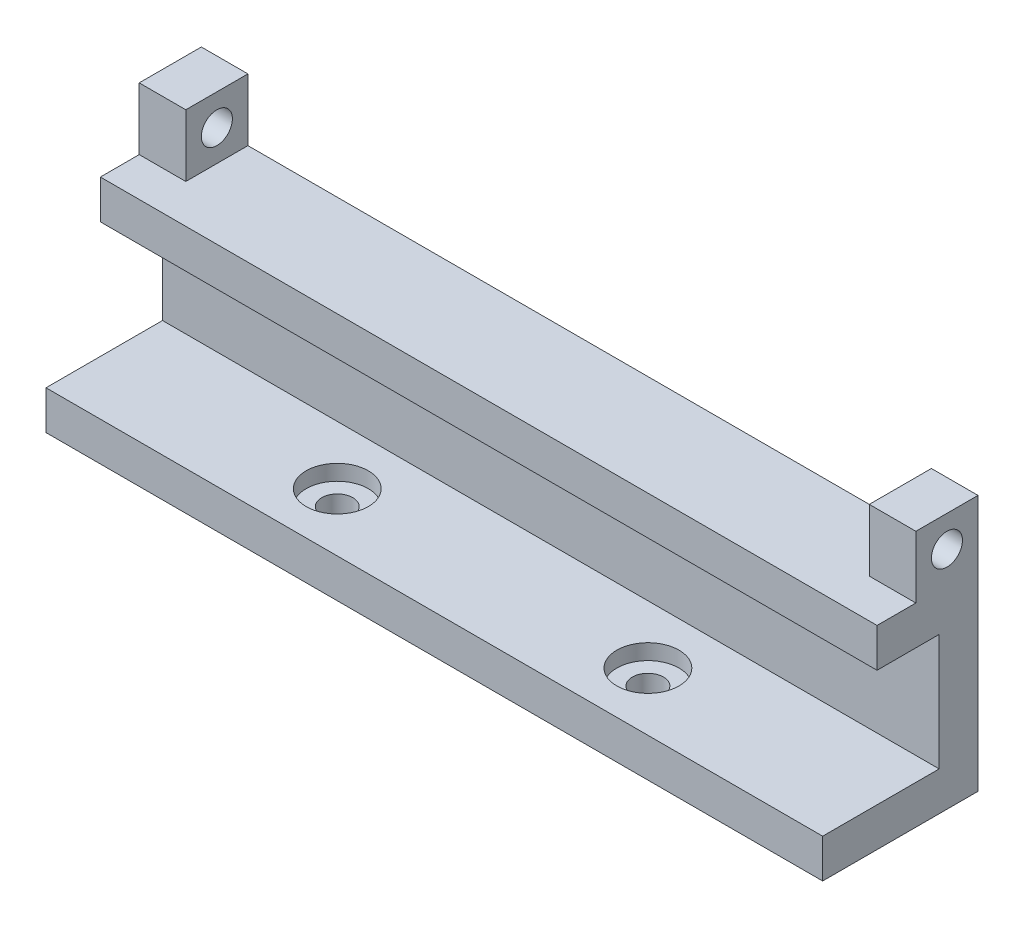
from build123d import *

# Parameters (mm, degrees)
SKETCH1_W               = 100
SKETCH1_H               = 20
SKETCH1_R               = 2
BOSS_EXTRUDE1_DEPTH     = 5
SKETCH2_W               = 100
SKETCH2_H               = 5
BOSS_EXTRUDE2_DEPTH     = 20
SKETCH3_W               = 100
SKETCH3_H               = 5
BOSS_EXTRUDE3_DEPTH     = 8
SKETCH4_R               = 4
CUT_EXTRUDE1_DEPTH      = 2
SKETCH5_W               = 6
SKETCH5_H               = 8
BOSS_EXTRUDE4_DEPTH     = 8
CUT_EXTRUDE2_DEPTH      = 102.612007165
CUT_EXTRUDE2_DEPTH_BACK = 102.612007165
SKETCH6_R               = 2


with BuildPart() as part:
    # Sketch1 → Boss-Extrude1 (new body)
    with BuildSketch(Plane(origin=(0, 0, 0), x_dir=(1, 0, 0), z_dir=(0, 1, 0))):
        with Locations((50, 10)):
            Rectangle(SKETCH1_W, SKETCH1_H)
        with Locations((30, 7.5)):
            Circle(SKETCH1_R, mode=Mode.SUBTRACT)
        with Locations((70, 7.5)):
            Circle(SKETCH1_R, mode=Mode.SUBTRACT)
    extrude(amount=BOSS_EXTRUDE1_DEPTH)

    # Sketch2 → Boss-Extrude2 (add)
    with BuildSketch(Plane(origin=(0, 5, 0), x_dir=(1, 0, 0), z_dir=(0, 1, 0))):
        with Locations((50, 17.5)):
            Rectangle(SKETCH2_W, SKETCH2_H)
    extrude(amount=BOSS_EXTRUDE2_DEPTH)

    # Sketch3 → Boss-Extrude3 (add)
    with BuildSketch(Plane.XY.offset(-15)):
        with Locations((50, 22.5)):
            Rectangle(SKETCH3_W, SKETCH3_H)
    extrude(amount=BOSS_EXTRUDE3_DEPTH)

    # Sketch4 → Cut-Extrude1 (cut)
    with BuildSketch(Plane(origin=(0, 5, 0), x_dir=(1, 0, 0), z_dir=(0, 1, 0))):
        with Locations((30, 7.5)):
            Circle(SKETCH4_R)
        with Locations((70, 7.5)):
            Circle(SKETCH4_R)
    extrude(amount=-CUT_EXTRUDE1_DEPTH, mode=Mode.SUBTRACT)

    # Sketch5 → Boss-Extrude4 (add)
    with BuildSketch(Plane(origin=(0, 25, 0), x_dir=(1, 0, 0), z_dir=(0, 1, 0))):
        with Locations((3, 16)):
            Rectangle(SKETCH5_W, SKETCH5_H)
        with Locations((97, 16)):
            Rectangle(SKETCH5_W, SKETCH5_H)
    extrude(amount=BOSS_EXTRUDE4_DEPTH)

    # Sketch6 → Cut-Extrude2 (cut, two sides: drawn at the far end of the back side and taken through both)
    with BuildSketch(Plane.ZY.offset(-94).offset(-CUT_EXTRUDE2_DEPTH_BACK)):
        with Locations((-16, 29)):
            Circle(SKETCH6_R)
    extrude(amount=CUT_EXTRUDE2_DEPTH + CUT_EXTRUDE2_DEPTH_BACK, mode=Mode.SUBTRACT)


solid = part.part
